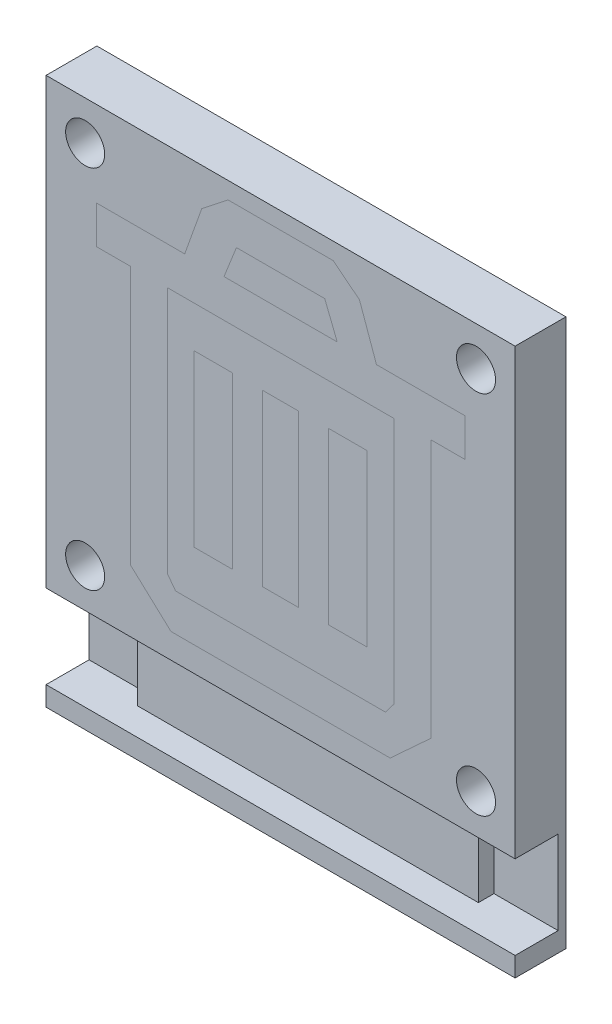
from build123d import *

# Parameters (mm, degrees)
SKETCH1_W               = 60
SKETCH1_H               = 70
BACK_PLATE_DEPTH        = 1
SKETCH1_W_2             = 4.935143629
SKETCH1_H_2             = 21.765245327
SKETCH1_W_3             = 4.588042919
SKETCH1_W_4             = 4.93514363
BACK_PLATE_2_DEPTH      = 1
BACK_PLATE_3_DEPTH      = 1
SKETCH1_4_W             = 43.6
SKETCH1_4_H             = 10.7
NEOPIXEL_BACK_DEPTH     = 3
SKETCH1_5_W             = 60
SKETCH1_5_H             = 56.8
SKETCH1_5_H_2           = 2.5
SKETCH1_5_W_2           = 4.935143629
SKETCH1_5_H_3           = 21.765245327
SKETCH1_5_W_3           = 4.588042919
SKETCH1_5_W_4           = 4.93514363
MAIN_COLOR_DEPTH        = 6.5
SKETCH2_R               = 2.5
MOUNTING_HOLES_DEPTH    = 6.5
HIGHLIGHT_COLOR_DEPTH   = 6.5
SKETCH1_7_W             = 4.588042919
SKETCH1_7_H             = 21.765245327
HIGHLIGHT_COLOR_2_DEPTH = 6.5
SKETCH1_7_W_2           = 4.935143629
HIGHLIGHT_COLOR_3_DEPTH = 6.5
SKETCH1_7_W_3           = 4.93514363
HIGHLIGHT_COLOR_4_DEPTH = 6.5


with BuildPart() as part:
    # Sketch1 → Back Plate (new body)
    with BuildSketch(Plane.XY):
        with Locations((-9.205009354, 26.879816243)):
            Rectangle(SKETCH1_W, SKETCH1_H)
        Polygon((-15.931296548, 59.717901756), (-2.47872216, 59.717901756), (0.883053973, 57.06304042), (3.059892719, 50.964477844), (14.363498017, 50.964477844), (14.363498017, 46.120048266), (10.011810175, 46.120048266), (10.011810175, 13.040245025), (4.81261813, 8.256222922), (-23.222636838, 8.256222922), (-28.421828882, 13.040245025), (-28.421828882, 46.120048266), (-32.773516724, 46.120048266), (-32.773516724, 50.964477844), (-21.469911426, 50.964477844), (-19.293072681, 57.06304042), align=None, mode=Mode.SUBTRACT)
    extrude(amount=BACK_PLATE_DEPTH)

    # Sketch1<4> → Neopixel Back (add)
    with BuildSketch(Plane.XY):
        with Locations((-9.205009354, -0.270183757)):
            Rectangle(SKETCH1_4_W, SKETCH1_4_H)
    extrude(amount=NEOPIXEL_BACK_DEPTH)

    # Sketch1<5> → Main Color (add)
    # profile 1 of 4: a face of its own
    with BuildSketch(Plane.XY):
        with Locations((-9.205009354, 33.479816243)):
            Rectangle(SKETCH1_5_W, SKETCH1_5_H)
        Polygon((-15.931296548, 59.717901756), (-2.47872216, 59.717901756), (0.883053973, 57.06304042), (3.059892719, 50.964477844), (14.363498017, 50.964477844), (14.363498017, 46.120048266), (10.011810175, 46.120048266), (10.011810175, 13.040245025), (4.81261813, 8.256222922), (-23.222636838, 8.256222922), (-28.421828882, 13.040245025), (-28.421828882, 46.120048266), (-32.773516724, 46.120048266), (-32.773516724, 50.964477844), (-21.469911426, 50.964477844), (-19.293072681, 57.06304042), align=None, mode=Mode.SUBTRACT)
    # profile 2 of 4: a face of its own
    with BuildSketch(Plane.XY):
        with Locations((-9.205009354, -6.870183757)):
            Rectangle(SKETCH1_5_W, SKETCH1_5_H_2)
    # profile 3 of 4: a face of its own
    with BuildSketch(Plane.XY):
        Polygon((-22.641480327, 13.040245025), (4.231461619, 13.040245025), (5.27634955, 14.450671464), (5.27634955, 46.120048266), (-23.686368257, 46.120048266), (-23.686368257, 14.450671464), align=None)
        with Locations((-17.810401185, 29.954349556)):
            Rectangle(SKETCH1_5_W_2, SKETCH1_5_H_3, mode=Mode.SUBTRACT)
        with Locations((-9.205009354, 29.954349556)):
            Rectangle(SKETCH1_5_W_3, SKETCH1_5_H_3, mode=Mode.SUBTRACT)
        with Locations((-0.599617523, 29.954349556)):
            Rectangle(SKETCH1_5_W_4, SKETCH1_5_H_3, mode=Mode.SUBTRACT)
    # profile 4 of 4: a face of its own
    with BuildSketch(Plane.XY):
        Polygon((-16.445688805, 50.964477844), (-1.964329902, 50.964477844), (-3.556374782, 54.971486207), (-14.853643925, 54.971486207), align=None)
    extrude(amount=MAIN_COLOR_DEPTH)


with BuildPart() as body_2:
    # Sketch1 → Back Plate 2 (new body)
    with BuildSketch(Plane.XY):
        Polygon((-22.641480327, 13.040245025), (4.231461619, 13.040245025), (5.27634955, 14.450671464), (5.27634955, 46.120048266), (-23.686368257, 46.120048266), (-23.686368257, 14.450671464), align=None)
        with Locations((-17.810401185, 29.954349556)):
            Rectangle(SKETCH1_W_2, SKETCH1_H_2, mode=Mode.SUBTRACT)
        with Locations((-9.205009354, 29.954349556)):
            Rectangle(SKETCH1_W_3, SKETCH1_H_2, mode=Mode.SUBTRACT)
        with Locations((-0.599617523, 29.954349556)):
            Rectangle(SKETCH1_W_4, SKETCH1_H_2, mode=Mode.SUBTRACT)
    extrude(amount=BACK_PLATE_2_DEPTH)


with BuildPart() as body_3:
    # Sketch1 → Back Plate 3 (new body)
    with BuildSketch(Plane.XY):
        Polygon((-16.445688805, 50.964477844), (-1.964329902, 50.964477844), (-3.556374782, 54.971486207), (-14.853643925, 54.971486207), align=None)
    extrude(amount=BACK_PLATE_3_DEPTH)


with BuildPart() as main_color_piece_1:
    # of the separate pieces the step leaves, piece 1, a body of its own (main_color_pieces)
    add(part.part.solids().sort_by_distance((20.794990646, 61.879816243, 6.5))[0])

    # Sketch2 → Mounting Holes (cut)
    with BuildSketch(Plane.XY.offset(6.5)):
        with Locations((-34.205009354, 56.879816243)):
            Circle(SKETCH2_R)
        with Locations((15.794990646, 56.879816243)):
            Circle(SKETCH2_R)
        with Locations((-34.205009354, 10.079816243)):
            Circle(SKETCH2_R)
        with Locations((15.794990646, 10.079816243)):
            Circle(SKETCH2_R)
    extrude(amount=-MOUNTING_HOLES_DEPTH, mode=Mode.SUBTRACT)


with BuildPart() as main_color_piece_2:
    # of the separate pieces the step leaves, piece 2, a body of its own (main_color_pieces)
    add(part.part.solids().sort_by_distance((-22.641480327, 13.040245025, 0))[0])


with BuildPart() as main_color_piece_3:
    # of the separate pieces the step leaves, piece 3, a body of its own (main_color_pieces)
    add(part.part.solids().sort_by_distance((-16.445688805, 50.964477844, 0))[0])


with BuildPart() as body_6:
    # Sketch1<7> → Highlight Color (new body)
    with BuildSketch(Plane.XY):
        Polygon((0.883053973, 57.06304042), (-2.47872216, 59.717901756), (-15.931296548, 59.717901756), (-19.293072681, 57.06304042), (-21.469911426, 50.964477844), (-32.773516724, 50.964477844), (-32.773516724, 46.120048266), (-28.421828882, 46.120048266), (-28.421828882, 13.040245025), (-23.222636838, 8.256222922), (4.81261813, 8.256222922), (10.011810175, 13.040245025), (10.011810175, 46.120048266), (14.363498017, 46.120048266), (14.363498017, 50.964477844), (3.059892719, 50.964477844), align=None)
        Polygon((5.27634955, 14.450671464), (4.231461619, 13.040245025), (-22.641480327, 13.040245025), (-23.686368257, 14.450671464), (-23.686368257, 46.120048266), (5.27634955, 46.120048266), align=None, mode=Mode.SUBTRACT)
        Polygon((-3.556374782, 54.971486207), (-1.964329902, 50.964477844), (-16.445688805, 50.964477844), (-14.853643925, 54.971486207), align=None, mode=Mode.SUBTRACT)
    extrude(amount=HIGHLIGHT_COLOR_DEPTH)


with BuildPart() as body_7:
    # Sketch1<7> → Highlight Color 2 (new body)
    with BuildSketch(Plane.XY):
        with Locations((-9.205009354, 29.954349556)):
            Rectangle(SKETCH1_7_W, SKETCH1_7_H)
    extrude(amount=HIGHLIGHT_COLOR_2_DEPTH)


with BuildPart() as body_8:
    # Sketch1<7> → Highlight Color 3 (new body)
    with BuildSketch(Plane.XY):
        with Locations((-17.810401185, 29.954349556)):
            Rectangle(SKETCH1_7_W_2, SKETCH1_7_H)
    extrude(amount=HIGHLIGHT_COLOR_3_DEPTH)


with BuildPart() as body_9:
    # Sketch1<7> → Highlight Color 4 (new body)
    with BuildSketch(Plane.XY):
        with Locations((-0.599617523, 29.954349556)):
            Rectangle(SKETCH1_7_W_3, SKETCH1_7_H)
    extrude(amount=HIGHLIGHT_COLOR_4_DEPTH)


solid = Compound([body_2.part, body_3.part, main_color_piece_1.part, main_color_piece_2.part, main_color_piece_3.part, body_6.part, body_7.part, body_8.part, body_9.part])
